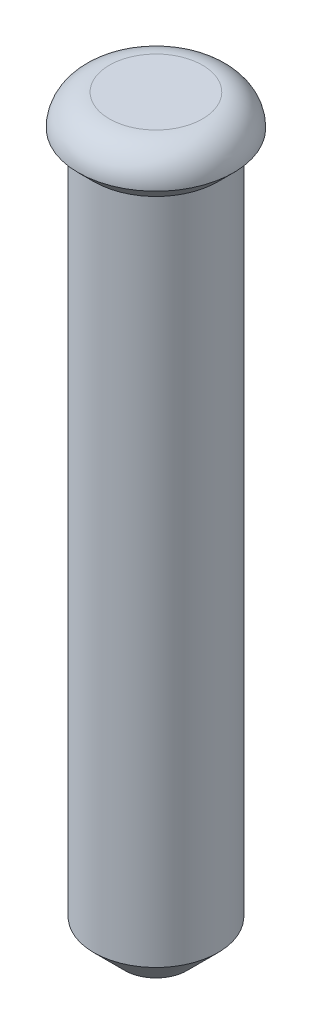
from build123d import *

# Parameters (mm, degrees)
SKETCH1_R           = 1
BOSS_EXTRUDE1_DEPTH = 11
SKETCH2_R           = 1.25
BOSS_EXTRUDE2_DEPTH = 1
CHAMFER1_SIZE       = 0.5
CHAMFER2_SIZE       = 0.5
FILLET1_R           = 0.5


# Some blends are built 0.0001 mm under size
with BuildPart() as part:
    # Sketch1 → Boss-Extrude1 (new body)
    with BuildSketch(Plane(origin=(0, 0, 0), x_dir=(1, 0, 0), z_dir=(0, 1, 0))):
        with Locations(Location((0, 0, 0), (0, 0, 270))):
            Circle(SKETCH1_R)
    extrude(amount=-BOSS_EXTRUDE1_DEPTH)

    # Sketch2 → Boss-Extrude2 (add)
    with BuildSketch(Plane(origin=(0, 0, 0), x_dir=(1, 0, 0), z_dir=(0, 1, 0))):
        with Locations(Location((0, 0, 0), (0, 0, 270))):
            Circle(SKETCH2_R)
    extrude(amount=BOSS_EXTRUDE2_DEPTH)

    # Chamfer1
    # the kernel refuses this chamfer: 0.5 mm, written as the material it takes off along each edge
    with BuildSketch(Plane(origin=(0, 0, 0), x_dir=(0, 0, 1), z_dir=(-1, 0, 0))) as chamfer1_piece_1_section:
        Polygon((1.25, CHAMFER1_SIZE), (1.25 - CHAMFER1_SIZE, 0), (1.25, 0), align=None)
    chamfer1_piece_1 = revolve(axis=Axis((0, 0, 0), (0, 1, 0)), mode=Mode.PRIVATE)
    chamfer1_piece_1 = chamfer1_piece_1 - Plane(origin=(0, 0.375686262, 0), x_dir=(0, 0, 1), z_dir=(0, 1, 0)) * Cylinder(1, 5, mode=Mode.PRIVATE)
    add(chamfer1_piece_1, mode=Mode.SUBTRACT)

    # Chamfer2
    chamfer2_edges = [part.edges().sort_by_distance(p)[0] for p in [
        (0, -11, -1),
    ]]
    chamfer(chamfer2_edges, length=CHAMFER2_SIZE)

    # Fillet1
    fillet1_edges = [part.edges().sort_by_distance(p)[0] for p in [
        (0, 1, -1.25),
    ]]
    fillet(fillet1_edges, radius=FILLET1_R - 0.0001)  # a hair under: the kernel refuses the full size


solid = part.part
